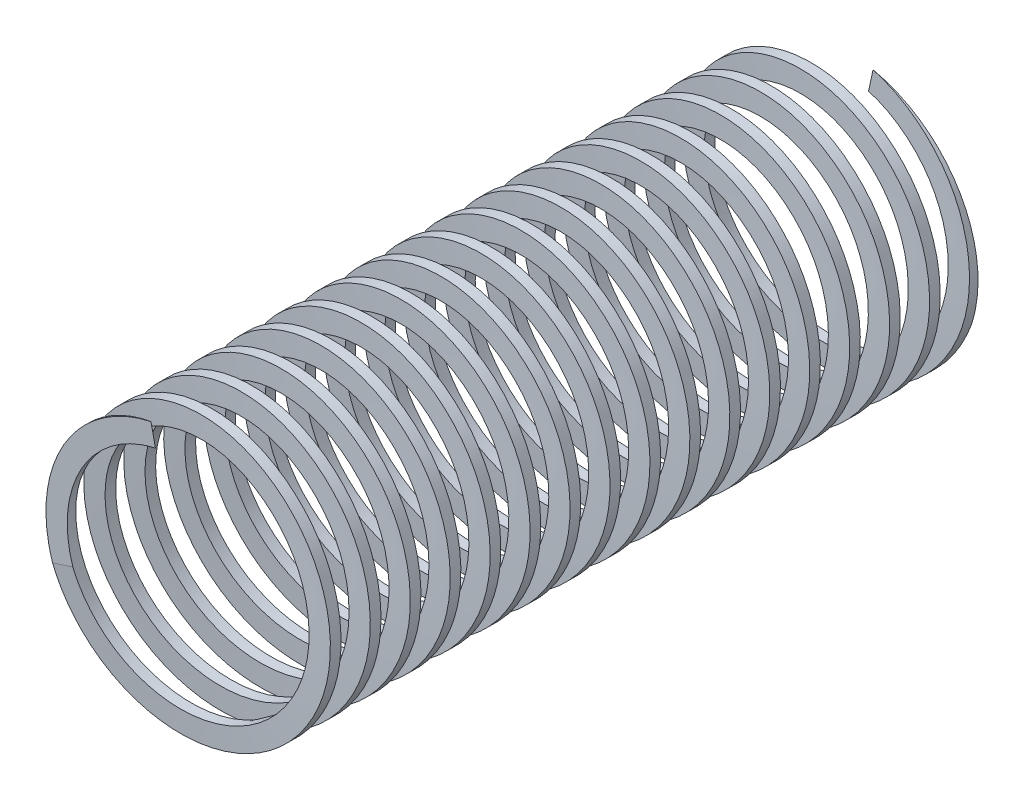
from build123d import *

# Parameters (mm, degrees)
BARRER1_PITCH              = 1.5
CORTAR_EXTRUIR1_DEPTH      = 10
CORTAR_EXTRUIR1_DEPTH_BACK = 10
CROQUIS3_OUTSIDE_W         = 18.502
CROQUIS3_OUTSIDE_H         = 37.777
CROQUIS3_OUTSIDE_W_2       = 13.748823853
CROQUIS3_OUTSIDE_H_2       = 25


with BuildPart() as part:
    # Barrer1: arcs per turn and ends read off the stored shape
    # Barrer1: the profile of Croquis2 screwed along a left-hand helix through 19.25 turns, 8 arcs to a turn; built about Z, then put on its axis
    barrer1_z = Axis((0, 0, 0), (0, 0, 1))
    barrer1_corners = [(0, -5, 0.2), (0, -5, -0.2), (0, -4.2, -0.2), (0, -4.2, 0.2)]
    with BuildLine(mode=Mode.PRIVATE) as barrer1_profile:
        Line(barrer1_corners[0], barrer1_corners[1])
        Line(barrer1_corners[1], barrer1_corners[2])
        Line(barrer1_corners[2], barrer1_corners[3])
        Line(barrer1_corners[3], barrer1_corners[0])
    barrer1_cap = Face(barrer1_profile.wire())
    barrer1_turn_angles = [0, -22.5, -45, -67.5, -90, -112.5, -135, -157.5, -180, -202.5, -225, -247.5, -270, -292.5, -315, -337.5, -360]
    barrer1_turn_weights = [1, 0.9238795325112867, 1, 0.9238795325112867, 1, 0.9238795325112867, 1, 0.9238795325112867, 1, 0.9238795325112867, 1, 0.9238795325112867, 1, 0.9238795325112867, 1, 0.9238795325112867, 1]
    barrer1_turn_rails = [Edge.make_bspline([Vector(p[0], p[1], 0).rotate(barrer1_z, barrer1_turn_angles[k]) / barrer1_turn_weights[k] + Vector(0, 0, p[2] + -BARRER1_PITCH * barrer1_turn_angles[k] / 360) for k in range(17)], [0, 0, 0, 1, 1, 2, 2, 3, 3, 4, 4, 5, 5, 6, 6, 7, 7, 8, 8, 8], 2, barrer1_turn_weights) for p in barrer1_corners]
    barrer1_turn_sides = [Face.make_surface_from_curves(barrer1_turn_rails[p[0]], barrer1_turn_rails[p[1]]) for p in [(0, 1), (1, 2), (2, 3), (3, 0)]]
    barrer1_last_angles = [-6840, -6862.5, -6885, -6907.5, -6930]
    barrer1_last_weights = [1, 0.9238795325112867, 1, 0.9238795325112867, 1]
    barrer1_last_rails = [Edge.make_bspline([Vector(p[0], p[1], 0).rotate(barrer1_z, barrer1_last_angles[k]) / barrer1_last_weights[k] + Vector(0, 0, p[2] + -BARRER1_PITCH * barrer1_last_angles[k] / 360) for k in range(5)], [0, 0, 0, 1, 1, 2, 2, 2], 2, barrer1_last_weights) for p in barrer1_corners]
    barrer1_last_sides = [Face.make_surface_from_curves(barrer1_last_rails[p[0]], barrer1_last_rails[p[1]]) for p in [(0, 1), (1, 2), (2, 3), (3, 0)]]
    barrer1 = Plane(origin=(0, 0, 0), x_dir=(1, 0, 0), z_dir=(0, 0, 1)) * Solid(Shell([*[p.moved(Location((0, 0, BARRER1_PITCH * i))) for i in range(19) for p in barrer1_turn_sides], *barrer1_last_sides, barrer1_cap, barrer1_cap.rotate(barrer1_z, -6930).moved(Location((0, 0, -BARRER1_PITCH * -6930 / 360)))]))
    add(barrer1)

    # Croquis3 outside → Cortar-Extruir1 (cut, two sides: drawn at the far end of the back side and taken through both)
    with BuildSketch(Plane(origin=(0, 0, 0), x_dir=(1, 0, 0), z_dir=(0, 1, 0)).offset(-CORTAR_EXTRUIR1_DEPTH_BACK)):
        with Locations((0, -14.4375)):
            Rectangle(CROQUIS3_OUTSIDE_W, CROQUIS3_OUTSIDE_H)
        with Locations((0.098205885, -13.5)):
            Rectangle(CROQUIS3_OUTSIDE_W_2, CROQUIS3_OUTSIDE_H_2, mode=Mode.SUBTRACT)
    extrude(amount=CORTAR_EXTRUIR1_DEPTH + CORTAR_EXTRUIR1_DEPTH_BACK, mode=Mode.SUBTRACT)


solid = part.part
